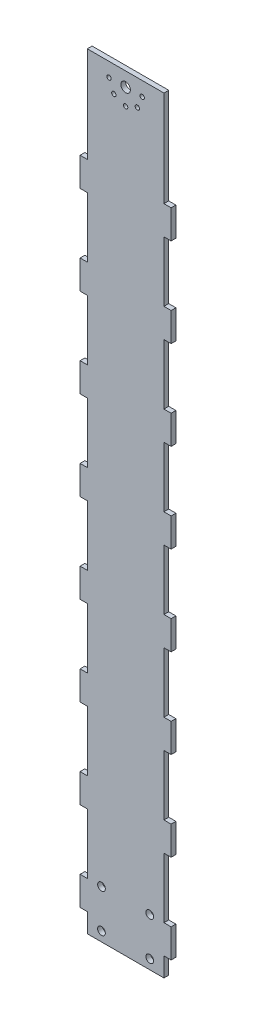
from build123d import *

# Parameters (mm, degrees)
SKETCH1_W                   = 50.8
SKETCH1_H                   = 508
BOSS_EXTRUDE1_DEPTH         = 3.175
M2_5_CLEARANCE_HOLE1_D      = 2.9
F_1_4_0_25_DIAMETER_HOLE1_D = 6.35
SKETCH6_W                   = 3.175
SKETCH6_H                   = 19.05
BOSS_EXTRUDE2_DEPTH         = 4.7625
CRVPATTERN1_START           = 25.4
CRVPATTERN1_OUTLINE_W       = 19.05
CRVPATTERN1_OUTLINE_H       = 3.175
CRVPATTERN1_DEPTH           = 4.7625
F_10_CLEARANCE_HOLE1_D      = 5.1054


# Read off the part's stored shape, not the designer's step: CrvPattern1
with BuildPart() as part:
    # Sketch1 → Boss-Extrude1 (new body)
    with BuildSketch(Plane.XY):
        Rectangle(SKETCH1_W, SKETCH1_H)
    extrude(amount=BOSS_EXTRUDE1_DEPTH)

    # M2.5 Clearance Hole1 (through all)
    with Locations(Plane.XY.offset(3.175)):
        with Locations((-11, 244.65), (-7.778174593, 236.871825407), (0, 233.65), (7.778174593, 236.871825407), (11, 244.65)):
            Hole(M2_5_CLEARANCE_HOLE1_D / 2)

    # 1/4 (0.25) Diameter Hole1 (through all)
    with Locations(Plane.XY.offset(3.175)):
        with Locations((0, 244.65)):
            Hole(F_1_4_0_25_DIAMETER_HOLE1_D / 2)

    # Sketch6 → Boss-Extrude2 (add)
    with BuildSketch(Plane(origin=(25.4, 0, 0), x_dir=(0, 0, -1), z_dir=(1, 0, 0))):
        with Locations((-1.5875, -231.775)):
            Rectangle(SKETCH6_W, SKETCH6_H)
    boss_extrude2 = extrude(amount=BOSS_EXTRUDE2_DEPTH)

    # CrvPattern1 outline → CrvPattern1 (add)
    with BuildSketch(Plane.YZ.offset(CRVPATTERN1_START)):
        with Locations((-172.810714286, 1.5875)):
            Rectangle(CRVPATTERN1_OUTLINE_W, CRVPATTERN1_OUTLINE_H)
        with Locations((-113.846428571, 1.5875)):
            Rectangle(CRVPATTERN1_OUTLINE_W, CRVPATTERN1_OUTLINE_H)
        with Locations((-54.882142857, 1.5875)):
            Rectangle(CRVPATTERN1_OUTLINE_W, CRVPATTERN1_OUTLINE_H)
        with Locations((4.082142857, 1.5875)):
            Rectangle(CRVPATTERN1_OUTLINE_W, CRVPATTERN1_OUTLINE_H)
        with Locations((63.046428571, 1.5875)):
            Rectangle(CRVPATTERN1_OUTLINE_W, CRVPATTERN1_OUTLINE_H)
        with Locations((122.010714286, 1.5875)):
            Rectangle(CRVPATTERN1_OUTLINE_W, CRVPATTERN1_OUTLINE_H)
        with Locations((180.975, 1.5875)):
            Rectangle(CRVPATTERN1_OUTLINE_W, CRVPATTERN1_OUTLINE_H)
    crvpattern1 = extrude(amount=CRVPATTERN1_DEPTH)

    # Mirror1: Boss-Extrude2, CrvPattern1 across plane
    add(boss_extrude2.mirror(Plane.ZY))
    add(crvpattern1.mirror(Plane.ZY))

    # #10 Clearance Hole1 (through all)
    with Locations(Plane.XY.offset(3.175)):
        with Locations((16.002, -247.65), (-16.002, -247.65), (16.002, -222.25), (-16.002, -222.25)):
            Hole(F_10_CLEARANCE_HOLE1_D / 2)


solid = part.part
